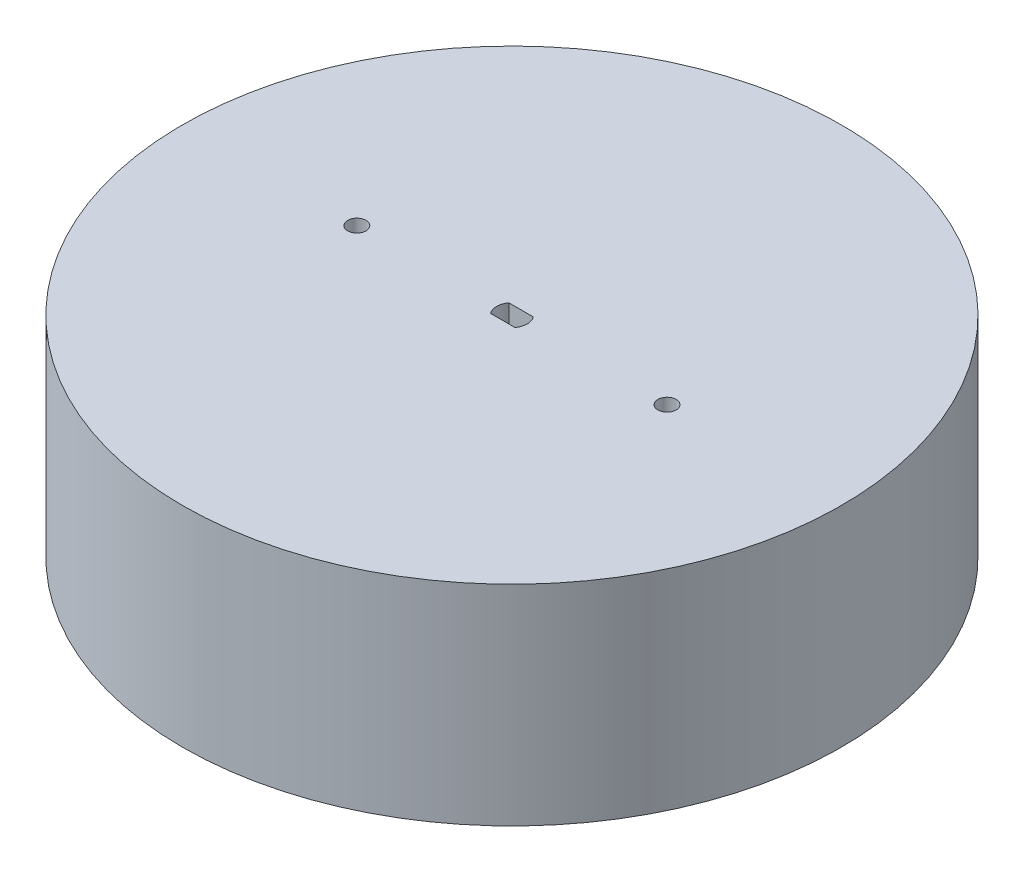
from build123d import *

# Parameters (mm, degrees)
SKETCH1_R           = 53.975
BOSS_EXTRUDE1_DEPTH = 8.89
BOSS_EXTRUDE2_START = -25.4
SKETCH1_4_R         = 53.975
SKETCH1_4_R_2       = 47.625
BOSS_EXTRUDE2_DEPTH = 25.4
CUT_EXTRUDE1_DEPTH  = 25.4
BOSS_EXTRUDE3_START = 3.4925
SKETCH3_R           = 47.625
SKETCH3_R_2         = 34.925
BOSS_EXTRUDE3_DEPTH = 3.4925
SKETCH4_R           = 1.5
CUT_EXTRUDE2_DEPTH  = 21.2725


with BuildPart() as part:
    # Sketch1 → Boss-Extrude1 (new body)
    with BuildSketch(Plane(origin=(0, 0, 0), x_dir=(1, 0, 0), z_dir=(0, 1, 0))):
        Circle(SKETCH1_R)
    extrude(amount=BOSS_EXTRUDE1_DEPTH)

    # Sketch1<4> → Boss-Extrude2 (add)
    with BuildSketch(Plane(origin=(0, 0, 0), x_dir=(1, 0, 0), z_dir=(0, 1, 0)).offset(BOSS_EXTRUDE2_START)):
        Circle(SKETCH1_4_R)
        Circle(SKETCH1_4_R_2, mode=Mode.SUBTRACT)
    extrude(amount=BOSS_EXTRUDE2_DEPTH)

    # Sketch2 → Cut-Extrude1 (cut)
    with BuildSketch(Plane(origin=(0, 8.89, 0), x_dir=(1, 0, 0), z_dir=(0, 1, 0))):
        with BuildLine():
            Line((-2, 1.5), (2, 1.5))
            ThreePointArc((2, 1.5), (2.5, 0), (2, -1.5))
            Line((2, -1.5), (-2, -1.5))
            ThreePointArc((-2, -1.5), (-2.5, 0), (-2, 1.5))
        make_face()
    extrude(amount=-CUT_EXTRUDE1_DEPTH, mode=Mode.SUBTRACT)

    # Sketch3 → Boss-Extrude3 (add)
    with BuildSketch(Plane.XZ.offset(BOSS_EXTRUDE3_START)):
        Circle(SKETCH3_R)
        Circle(SKETCH3_R_2, mode=Mode.SUBTRACT)
    extrude(amount=-BOSS_EXTRUDE3_DEPTH)

    # Sketch4 → Cut-Extrude2 (cut)
    with BuildSketch(Plane(origin=(0, 8.89, 0), x_dir=(1, 0, 0), z_dir=(0, 1, 0))):
        with Locations((25.4, 0)):
            Circle(SKETCH4_R)
        with Locations((-25.4, 0)):
            Circle(SKETCH4_R)
    extrude(amount=-CUT_EXTRUDE2_DEPTH, mode=Mode.SUBTRACT)


solid = part.part
